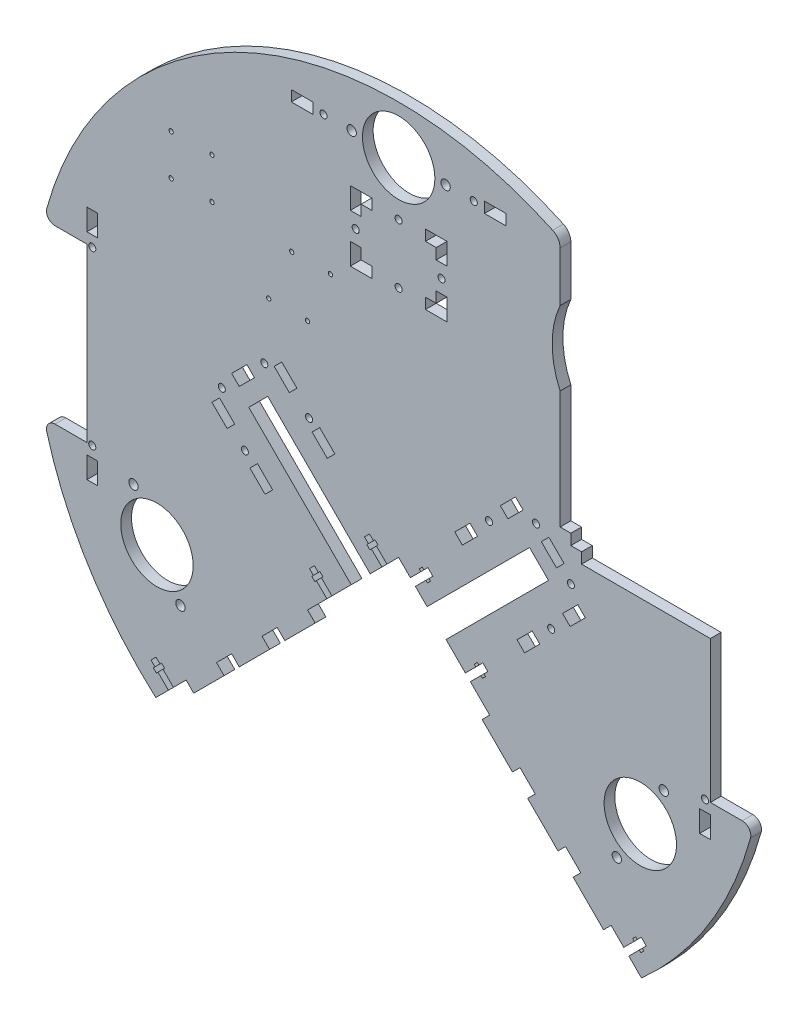
from build123d import *

# Parameters (mm, degrees)
SKETCH1_R                        = 215.9
BASE_PLATE_EXTRUSION_DEPTH       = 6.35
V_FUNNEL_CUT_DEPTH               = 306.394732273
WHEEL_TRACK_CUT_DEPTH            = 306.394732273
SILO_PICKER_CLEARANCE_DEPTH      = 302.140004815
SKETCH6_W                        = 6.35
SKETCH6_H                        = 25.4
V_FUNNEL_TAB_LEFT_DEPTH          = 6.35
V_FUNNEL_TAB_PATTERN_LEFT_COUNT  = 3
V_FUNNEL_TAB_PATTERN_LEFT_PITCH  = 38.1
SKETCH7_W                        = 6.35
SKETCH7_H                        = 25.4
V_FUNNEL_TAB_RIGHT_DEPTH         = 6.35
V_FUNNEL_TAB_PATTERN_RIGHT_COUNT = 3
V_FUNNEL_TAB_PATTERN_RIGHT_PITCH = 38.1
SILO_ARM_TAB_HOLES_DEPTH         = 6.35
DUMP_ARM_TAB_HOLES_DEPTH         = 6.35
SKETCH11_W                       = 6.35
SKETCH11_H                       = 12.7
WHEEL_SUPPORT_TAB_HOLES_DEPTH    = 6.35
SKETCH13_R                       = 21.43125
SKETCH13_R_2                     = 2.778125
CASTER_WHEEL_HOLE_DEPTH          = 302.140004815
SKETCH14_R                       = 2.0955
WHEEL_SUPPORT_HOLE_DEPTH         = 302.140004815
V_FUNNEL_T_SLOT_CUT_OUT_DEPTH    = 302.140004815
SKETCH19_R                       = 2.0955
SWITCH_PLATE_HOLES_DEPTH         = 302.140004815
SKETCH20_W                       = 12.7
SKETCH20_H                       = 6.35
SWITH_PLATE_TAB_HOLES_DEPTH      = 302.140004815
SKETCH26_R                       = 2.0955
SILO_ARM_HOLES_DEPTH             = 302.140004815
SKETCH27_R                       = 2.0955
DUMP_ARM_HOLES_DEPTH             = 302.140004815
WHEEL_SLOT_FILLET_R              = 5.08
SKETCH28_R                       = 21.43125
SKETCH28_R_2                     = 2.778125
FRONT_CASTER_HOLES_DEPTH         = 301.111238031
GYRO_HOLES_R                     = 1.27
GYROHOLES_DEPTH                  = 301.111238031
SKETCH31_R                       = 1.27
BUCKCONVERTERHOLES_DEPTH         = 301.111238031
CUT_EXTRUDE6_DEPTH               = 301.111238031
SKETCH35_R                       = 2.0955
CUT_EXTRUDE7_DEPTH               = 301.111238031
CUT_EXTRUDE13_DEPTH              = 301.111238031
FILLET1_R                        = 7.62
CUT_EXTRUDE14_DEPTH              = 301.111238031


with BuildPart() as part:
    # Sketch1 → Base Plate Extrusion (new body)
    with BuildSketch(Plane.XY):
        Circle(SKETCH1_R)
    extrude(amount=BASE_PLATE_EXTRUSION_DEPTH)

    # Sketch2 → V Funnel Cut (cut, through all)
    with BuildSketch(Plane.XY.offset(6.35)):
        with BuildLine():
            Line((0, -17.460836827), (143.684097937, -161.144934764))
            ThreePointArc((143.684097937, -161.144934764), (0, -215.9), (-143.684097937, -161.144934764))
            Line((-143.684097937, -161.144934764), (0, -17.460836827))
        make_face()
    extrude(amount=-V_FUNNEL_CUT_DEPTH, mode=Mode.SUBTRACT)

    # Sketch3 → Wheel Track Cut (cut, through all)
    with BuildSketch(Plane.XY.offset(6.35)):
        with BuildLine():
            Line((184.438437852, 50.8), (184.438437852, -50.8))
            Line((184.438437852, -50.8), (209.838437852, -50.8))
            ThreePointArc((209.838437852, -50.8), (215.9, 0), (209.838437852, 50.8))
            Line((209.838437852, 50.8), (184.438437852, 50.8))
        make_face()
    wheel_track_cut = extrude(amount=-WHEEL_TRACK_CUT_DEPTH, mode=Mode.SUBTRACT)

    # Wheel Track Cut Mirror: Wheel Track Cut across plane
    add(wheel_track_cut.mirror(Plane(origin=(0, 0, 0), x_dir=(0, 0, 1), z_dir=(1, 0, 0))), mode=Mode.SUBTRACT)

    # Sketch4 → Silo Picker Clearance (cut, through all)
    with BuildSketch(Plane.XY.offset(6.35)):
        Polygon((88.680029196, 15.092591612), (77.454709044, 26.317911764), (16.837980227, -34.298817054), (28.063300378, -45.524137205), align=None)
    silo_picker_clearance = extrude(amount=-SILO_PICKER_CLEARANCE_DEPTH, mode=Mode.SUBTRACT)

    # Dump Picker Clearance: Silo Picker Clearance across plane
    add(silo_picker_clearance.mirror(Plane(origin=(0, 0, 0), x_dir=(0, 0, 1), z_dir=(1, 0, 0))), mode=Mode.SUBTRACT)

    # Sketch6 → V Funnel Tab Left (add)
    with BuildSketch(Plane(origin=(8.730418413, -8.730418413, 0), x_dir=(0, 0, -1), z_dir=(0.7071067811865467, -0.7071067811865485, 0))):
        with Locations((-3.175, -177.446676125)):
            Rectangle(SKETCH6_W, SKETCH6_H)
    v_funnel_tab_left = extrude(amount=V_FUNNEL_TAB_LEFT_DEPTH)

    # V Funnel Tab Pattern Left: V Funnel Tab Left ×3
    with Locations(*[Vector(0.7071067811865486, 0.7071067811865466, 0) * (i * V_FUNNEL_TAB_PATTERN_LEFT_PITCH) for i in range(1, V_FUNNEL_TAB_PATTERN_LEFT_COUNT)]):
        add(v_funnel_tab_left)

    # Sketch7 → V Funnel Tab Right (add)
    with BuildSketch(Plane(origin=(-8.730418413, -8.730418413, 0), x_dir=(0, 0, 1), z_dir=(-0.707106781186546, -0.707106781186549, 0))):
        with Locations((3.175, -177.446676125)):
            Rectangle(SKETCH7_W, SKETCH7_H)
    v_funnel_tab_right = extrude(amount=V_FUNNEL_TAB_RIGHT_DEPTH)

    # V Funnel Tab Pattern Right: V Funnel Tab Right ×3
    with Locations(*[Vector(-0.707106781186549, 0.707106781186546, 0) * (i * V_FUNNEL_TAB_PATTERN_RIGHT_PITCH) for i in range(1, V_FUNNEL_TAB_PATTERN_RIGHT_COUNT)]):
        add(v_funnel_tab_right)

    # Sketch8 → Silo Arm Tab Holes (cut)
    with BuildSketch(Plane(origin=(0, 0, 0), x_dir=(-1, 0, 0), z_dir=(0, 0, -1))):
        Polygon((-70.045997744, -24.645041723), (-79.026253865, -15.664785602), (-83.516381926, -20.154913663), (-74.536125805, -29.135169784), align=None)
        Polygon((-96.986766108, 2.29572664), (-101.476894168, -2.194401421), (-110.457150289, 6.7858547), (-105.967022229, 11.275982761), align=None)
        Polygon((-97.89653577, 28.32672534), (-88.916279649, 37.306981461), (-84.426151589, 32.816853401), (-93.40640771, 23.83659728), align=None)
        Polygon((-64.657844072, 34.624648676), (-60.167716011, 39.114776736), (-69.147972132, 48.095032857), (-73.638100193, 43.604904797), align=None)
        Polygon((-46.69733183, 16.664136433), (-42.207203769, 21.154264494), (-33.226947648, 12.174008373), (-37.717075708, 7.683880312), align=None)
    extrude(amount=-SILO_ARM_TAB_HOLES_DEPTH, mode=Mode.SUBTRACT)

    # Sketch10 → Dump Arm Tab Holes (cut)
    with BuildSketch(Plane(origin=(0, 0, 0), x_dir=(-1, 0, 0), z_dir=(0, 0, -1))):
        Polygon((51.18745989, 21.154264494), (42.207203769, 12.174008373), (37.717075708, 16.664136433), (46.69733183, 25.644392555), align=None)
        Polygon((64.657844072, 34.624648676), (60.167716011, 39.114776736), (69.147972132, 48.095032857), (73.638100193, 43.604904797), align=None)
        Polygon((89.802561211, 36.4206999), (85.31243315, 31.930571839), (94.292689271, 22.950315718), (98.782817332, 27.440443779), align=None)
        Polygon((105.967022229, 11.275982761), (96.986766108, 2.29572664), (101.476894168, -2.194401421), (110.457150289, 6.7858547), align=None)
        Polygon((88.006509986, -15.664785602), (83.516381926, -11.174657542), (74.536125805, -20.154913663), (79.026253865, -24.645041723), align=None)
    extrude(amount=-DUMP_ARM_TAB_HOLES_DEPTH, mode=Mode.SUBTRACT)

    # Sketch11 → Wheel Support Tab Holes (cut)
    with BuildSketch(Plane(origin=(0, 0, 0), x_dir=(-1, 0, 0), z_dir=(0, 0, -1))):
        with Locations((181.263437852, -63.5)):
            Rectangle(SKETCH11_W, SKETCH11_H)
        with Locations((181.263437852, 63.5)):
            Rectangle(SKETCH11_W, SKETCH11_H)
        with Locations((-181.263437852, -63.5)):
            Rectangle(SKETCH11_W, SKETCH11_H)
        with Locations((-181.263437852, 63.5)):
            Rectangle(SKETCH11_W, SKETCH11_H)
    extrude(amount=-WHEEL_SUPPORT_TAB_HOLES_DEPTH, mode=Mode.SUBTRACT)

    # Sketch13 → Caster Wheel Hole (cut, through all)
    with BuildSketch(Plane.XY.offset(6.35)):
        with Locations((0, 187.325)):
            Circle(SKETCH13_R)
        with Locations((27.78125, 187.325)):
            Circle(SKETCH13_R_2)
        with Locations((-27.78125, 187.325)):
            Circle(SKETCH13_R_2)
    extrude(amount=-CASTER_WHEEL_HOLE_DEPTH, mode=Mode.SUBTRACT)

    # Sketch14 → Wheel Support Hole (cut, through all)
    with BuildSketch(Plane.XY.offset(6.35)):
        with Locations((181.263437852, 50.8)):
            Circle(SKETCH14_R)
        with Locations((181.263437852, -50.8)):
            Circle(SKETCH14_R)
    wheel_support_hole = extrude(amount=-WHEEL_SUPPORT_HOLE_DEPTH, mode=Mode.SUBTRACT)

    # Wheel Support Hole Mirror: Wheel Support Hole across plane
    add(wheel_support_hole.mirror(Plane(origin=(0, 0, 0), x_dir=(0, 0, 1), z_dir=(1, 0, 0))), mode=Mode.SUBTRACT)

    # Sketch15 → V Funnel T Slot Cut Out (cut, through all)
    with BuildSketch(Plane.XY.offset(6.35)):
        Polygon((-136.185584076, -153.646420903), (-133.222099556, -150.682936383), (-139.41847628, -144.486559659), (-138.475549387, -143.543632766), (-140.271600611, -141.747581542), (-141.214527504, -142.690508435), (-143.549394095, -140.355641843), (-146.512878615, -143.319126363), (-144.178012024, -145.653992955), (-145.120938916, -146.596919848), (-143.324887692, -148.392971072), (-142.3819608, -147.450044179), align=None)
        Polygon((-42.454160812, -59.914997639), (-39.490676292, -56.951513119), (-45.687053016, -50.755136395), (-44.744126123, -49.812209503), (-46.540177347, -48.016158279), (-47.48310424, -48.959085171), (-49.817970832, -46.62421858), (-52.781455352, -49.5877031), (-50.44658876, -51.922569691), (-51.389515653, -52.865496584), (-49.593464429, -54.661547808), (-48.650537536, -53.718620915), align=None)
        Polygon((-9.900732373, -27.3615692), (-6.937247854, -24.39808468), (-13.133624577, -18.201707957), (-12.190697684, -17.258781064), (-13.986748909, -15.46272984), (-14.929675801, -16.405656732), (-17.264542393, -14.070790141), (-20.228026913, -17.034274661), (-17.893160321, -19.369141252), (-18.836087214, -20.312068145), (-17.04003599, -22.108119369), (-16.097109097, -21.165192477), align=None)
    v_funnel_t_slot_cut_out = extrude(amount=-V_FUNNEL_T_SLOT_CUT_OUT_DEPTH, mode=Mode.SUBTRACT)

    # V Funnel T Slot Cut Out Mirror: V Funnel T Slot Cut Out across plane
    add(v_funnel_t_slot_cut_out.mirror(Plane(origin=(0, 0, 0), x_dir=(0, 0, 1), z_dir=(1, 0, 0))), mode=Mode.SUBTRACT)

    # Sketch19 → Switch Plate Holes (cut, through all)
    with BuildSketch(Plane.XY.offset(6.35)):
        with Locations((44.45, 187.325)):
            Circle(SKETCH19_R)
        with Locations((-44.45, 187.325)):
            Circle(SKETCH19_R)
    extrude(amount=-SWITCH_PLATE_HOLES_DEPTH, mode=Mode.SUBTRACT)

    # Sketch20 → Swith Plate Tab Holes (cut, through all)
    with BuildSketch(Plane(origin=(0, 0, 0), x_dir=(-1, 0, 0), z_dir=(0, 0, -1))):
        with Locations((-57.15, 187.325)):
            Rectangle(SKETCH20_W, SKETCH20_H)
        with Locations((57.15, 187.325)):
            Rectangle(SKETCH20_W, SKETCH20_H)
    extrude(amount=-SWITH_PLATE_TAB_HOLES_DEPTH, mode=Mode.SUBTRACT)

    # Sketch26 → Silo Arm Holes (cut, through all)
    with BuildSketch(Plane.XY.offset(6.35)):
        with Locations((90.251574017, -8.929593512)):
            Circle(SKETCH26_R)
        with Locations((53.43252392, 27.889456585)):
            Circle(SKETCH26_R)
        with Locations((101.931779, 19.80135405)):
            Circle(SKETCH26_R)
        with Locations((81.277189921, 40.455943129)):
            Circle(SKETCH26_R)
    extrude(amount=-SILO_ARM_HOLES_DEPTH, mode=Mode.SUBTRACT)

    # Sketch27 → Dump Arm Holes (cut, through all)
    with BuildSketch(Plane.XY.offset(6.35)):
        with Locations((-52.983511114, 27.440443779)):
            Circle(SKETCH27_R)
        with Locations((-79.475266671, 42.257866379)):
            Circle(SKETCH27_R)
        with Locations((-104.61998381, 17.11314924)):
            Circle(SKETCH27_R)
        with Locations((-90.969994506, -8.211173022)):
            Circle(SKETCH27_R)
    extrude(amount=-DUMP_ARM_HOLES_DEPTH, mode=Mode.SUBTRACT)

    # Wheel Slot Fillet
    wheel_slot_fillet_edges = [part.edges().sort_by_distance(p)[0] for p in [
        (209.838437852, -50.8, 3.175),
        (209.838437852, 50.8, 3.175),
        (-209.838437852, -50.8, 3.175),
        (-209.838437852, 50.8, 3.175),
    ]]
    fillet(wheel_slot_fillet_edges, radius=WHEEL_SLOT_FILLET_R)

    # Sketch28 → Front Caster Holes (cut, through all)
    with BuildSketch(Plane.XY.offset(6.35)):
        with Locations((-142.980794165, -82.55)):
            Circle(SKETCH28_R)
        with Locations((-156.871419165, -58.490731751)):
            Circle(SKETCH28_R_2)
        with Locations((-129.090169165, -106.609268249)):
            Circle(SKETCH28_R_2)
    front_caster_holes = extrude(amount=-FRONT_CASTER_HOLES_DEPTH, mode=Mode.SUBTRACT)

    # Front Caster Hole Mirror: Front Caster Holes across plane
    add(front_caster_holes.mirror(Plane(origin=(0, 0, 0), x_dir=(0, 0, 1), z_dir=(1, 0, 0))), mode=Mode.SUBTRACT)

    # Gyro Holes → GyroHoles (cut, through all)
    with BuildSketch(Plane.XY.offset(6.35)):
        with Locations((-134.568187596, 133.592601438)):
            Circle(GYRO_HOLES_R)
        with Locations((-110.438187596, 133.592601438)):
            Circle(GYRO_HOLES_R)
        with Locations((-110.438187596, 109.462601438)):
            Circle(GYRO_HOLES_R)
        with Locations((-134.568187596, 109.462601438)):
            Circle(GYRO_HOLES_R)
    extrude(amount=-GYROHOLES_DEPTH, mode=Mode.SUBTRACT)

    # Sketch31 → BuckConverterHoles (cut, through all)
    with BuildSketch(Plane.XY.offset(6.35)):
        with Locations((-76.88879011, 76.754063143)):
            Circle(SKETCH31_R)
        with Locations((-63.278477516, 107.506451461)):
            Circle(SKETCH31_R)
        with Locations((-53.919054985, 76.754063143)):
            Circle(SKETCH31_R)
        with Locations((-40.308742391, 107.506451461)):
            Circle(SKETCH31_R)
    extrude(amount=-BUCKCONVERTERHOLES_DEPTH, mode=Mode.SUBTRACT)

    # Sketch34 → Cut-Extrude6 (cut, through all)
    with BuildSketch(Plane(origin=(0, 0, 0), x_dir=(-1, 0, 0), z_dir=(0, 0, -1))):
        Polygon((-28.575, 158.75), (-15.875, 158.75), (-15.875, 152.4), (-22.225, 152.4), (-22.225, 146.05), (-28.575, 146.05), (-28.575, 152.4), align=None)
        Polygon((15.875, 158.75), (28.575, 158.75), (28.575, 152.4), (28.575, 146.05), (22.225, 146.05), (22.225, 152.4), (15.875, 152.4), align=None)
        Polygon((15.875, 123.825), (22.225, 123.825), (22.225, 130.175), (28.575, 130.175), (28.575, 123.825), (28.575, 117.475), (15.875, 117.475), align=None)
        Polygon((-22.225, 123.825), (-15.875, 123.825), (-15.875, 117.475), (-28.575, 117.475), (-28.575, 123.825), (-28.575, 130.175), (-22.225, 130.175), align=None)
    extrude(amount=-CUT_EXTRUDE6_DEPTH, mode=Mode.SUBTRACT)

    # Sketch35 → Cut-Extrude7 (cut, through all)
    with BuildSketch(Plane.XY.offset(6.35)):
        with Locations((0, 120.65)):
            Circle(SKETCH35_R)
        with Locations((25.4, 138.1125)):
            Circle(SKETCH35_R)
        with Locations((0, 155.575)):
            Circle(SKETCH35_R)
        with Locations((-25.4, 138.1125)):
            Circle(SKETCH35_R)
    extrude(amount=-CUT_EXTRUDE7_DEPTH, mode=Mode.SUBTRACT)

    # Sketch41 → Cut-Extrude13 (cut, through all)
    with BuildSketch(Plane.XY.offset(6.35)):
        Polygon((95.538437852, 193.610993729), (95.538437852, 45.87632042), (101.888437852, 45.87632042), (101.888437852, 39.52632042), (108.238437852, 39.52632042), (108.238437852, 33.17632042), (218.860535053, 33.17632042), (218.860535053, 193.610993729), align=None)
    extrude(amount=-CUT_EXTRUDE13_DEPTH, mode=Mode.SUBTRACT)

    # Fillet1
    fillet1_edges = [part.edges().sort_by_distance(p)[0] for p in [
        (95.538437852, 193.610993729, 3.175),
    ]]
    fillet(fillet1_edges, radius=FILLET1_R)

    # Sketch42 → Cut-Extrude14 (cut, through all)
    with BuildSketch(Plane.XY.offset(6.35)):
        with BuildLine():
            Line((95.538437852, 159.30810977), (95.538437852, 115.573937206))
            ThreePointArc((95.538437852, 115.573937206), (90.813693084, 137.441023488), (95.538437852, 159.30810977))
        make_face()
    extrude(amount=-CUT_EXTRUDE14_DEPTH, mode=Mode.SUBTRACT)


solid = part.part
